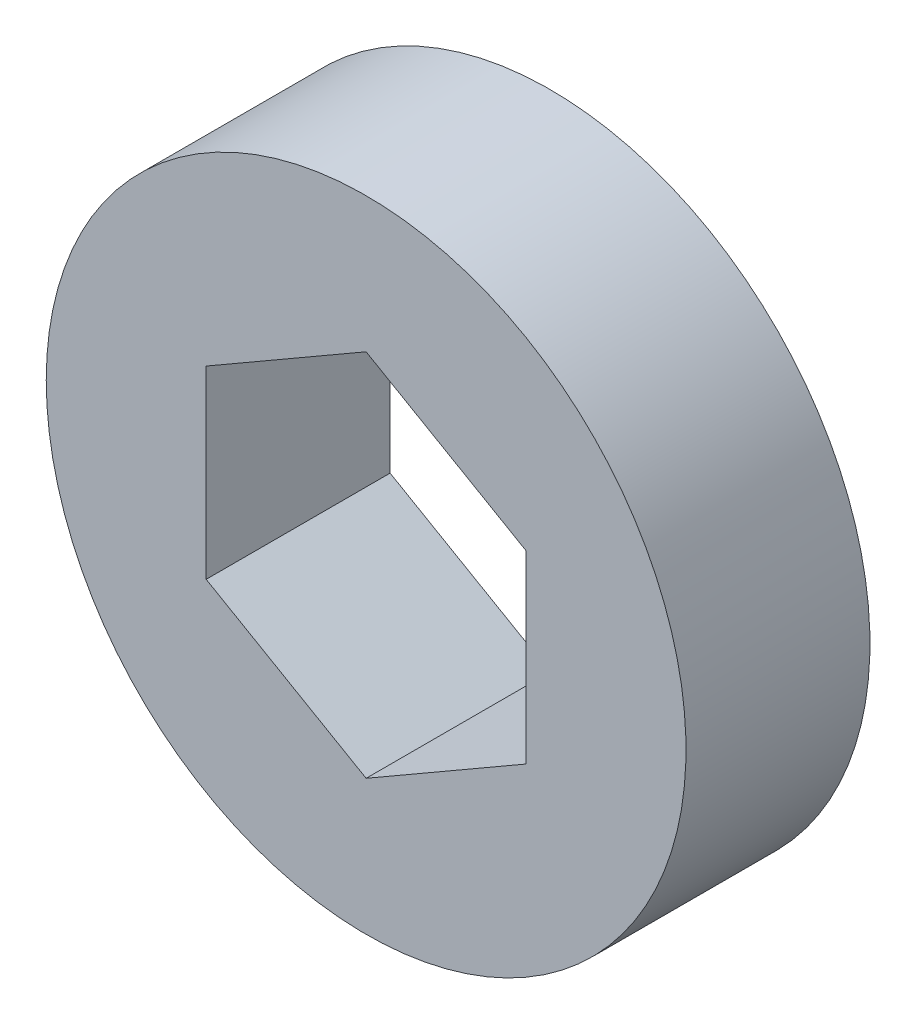
from build123d import *

# Parameters (mm, degrees)
SKETCH1_R           = 12.7
BOSS_EXTRUDE1_DEPTH = 3.65125


with BuildPart() as part:
    # Sketch1 → Boss-Extrude1 (new, symmetric)
    with BuildSketch(Plane.XY):
        Circle(SKETCH1_R)
        Polygon((0, 7.332348419), (-6.35, 3.666174209), (-6.35, -3.666174209), (0, -7.332348419), (6.35, -3.666174209), (6.35, 3.666174209), align=None, mode=Mode.SUBTRACT)
    extrude(amount=BOSS_EXTRUDE1_DEPTH, both=True)


solid = part.part
